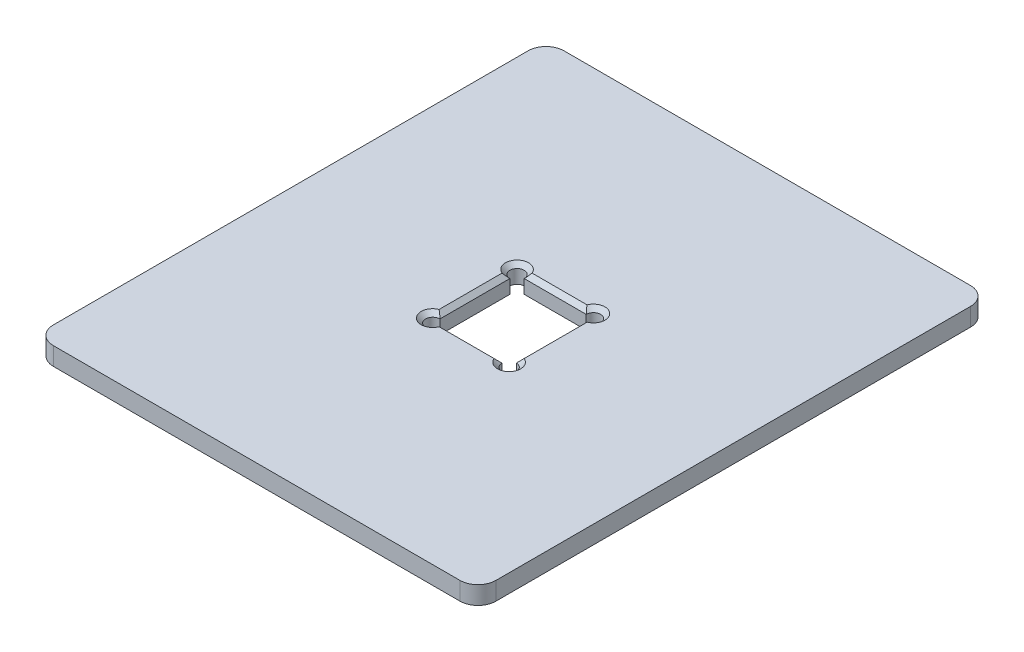
from build123d import *

# Parameters (mm, degrees)
SKETCH1_W           = 78
SKETCH1_H           = 90
BOSS_EXTRUDE1_DEPTH = 3.175
FILLET1_R           = 3.175
CHAMFER1_SIZE       = 0.762


with BuildPart() as part:
    # Sketch1 → Boss-Extrude1 (new body)
    with BuildSketch(Plane(origin=(0, 0, 0), x_dir=(1, 0, 0), z_dir=(0, 1, 0))):
        with Locations((2.2e-08, 4.3e-08)):
            Rectangle(SKETCH1_W, SKETCH1_H)
        with BuildLine():
            Line((-5.334, 7.493), (5.588, 7.493))
            ThreePointArc((5.588, 7.493), (7.756025612, 8.391025612), (6.858, 6.223))
            Line((6.858, 6.223), (6.858, -6.096))
            ThreePointArc((6.858, -6.096), (7.756025612, -8.264025612), (5.588, -7.366))
            Line((5.588, -7.366), (-5.334, -7.366))
            ThreePointArc((-5.334, -7.366), (-7.502025612, -8.264025612), (-6.604, -6.096))
            Line((-6.604, -6.096), (-6.604, 6.223))
            ThreePointArc((-6.604, 6.223), (-7.502025612, 8.391025612), (-5.334, 7.493))
        make_face(mode=Mode.SUBTRACT)
    extrude(amount=BOSS_EXTRUDE1_DEPTH)

    # Fillet1
    fillet1_edges = [part.edges().sort_by_distance(p)[0] for p in [
        (-38.999999978, 1.5875, -45.000000043),
        (39.000000022, 1.5875, -45.000000043),
        (39.000000022, 1.5875, 44.999999957),
        (-38.999999978, 1.5875, 44.999999957),
    ]]
    fillet(fillet1_edges, radius=FILLET1_R)

    # Chamfer1
    chamfer1_edges = [part.edges().sort_by_distance(p)[0] for p in [
        (-6.604, 3.175, -0.0635),
        (-7.502025612, 3.175, 8.264025612),
        (0.127, 3.175, 7.366),
        (7.756025612, 3.175, 8.264025612),
        (6.858, 3.175, -0.0635),
        (7.756025612, 3.175, -8.391025612),
        (0.127, 3.175, -7.493),
        (-7.502025612, 3.175, -8.391025612),
    ]]
    chamfer(chamfer1_edges, length=CHAMFER1_SIZE)


solid = part.part
